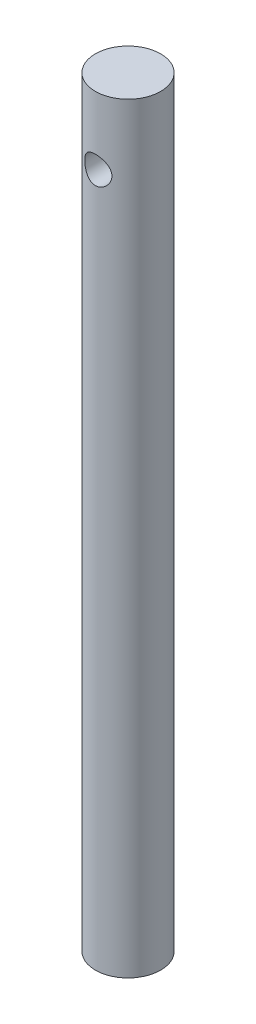
from build123d import *

# Parameters (mm, degrees)
SKETCH1_W               = 6
SKETCH1_H               = 140
CUT_EXTRUDE2_DEPTH      = 141.256907138
CUT_EXTRUDE2_DEPTH_BACK = 141.256907138
SKETCH4_R               = 2.5


with BuildPart() as part:
    # Sketch1 → Revolve1 (revolve)
    with BuildSketch(Plane.XY):
        with Locations((-3, 70)):
            Rectangle(SKETCH1_W, SKETCH1_H)
    revolve(axis=Axis((0, 0, 0), (0, 1, 0)))

    # Sketch4 → Cut-Extrude2 (cut, two sides: drawn at the far end of the back side and taken through both)
    with BuildSketch(Plane.XY.offset(-CUT_EXTRUDE2_DEPTH_BACK)):
        with Locations((0, 127.5)):
            Circle(SKETCH4_R)
    extrude(amount=CUT_EXTRUDE2_DEPTH + CUT_EXTRUDE2_DEPTH_BACK, mode=Mode.SUBTRACT)


solid = part.part
